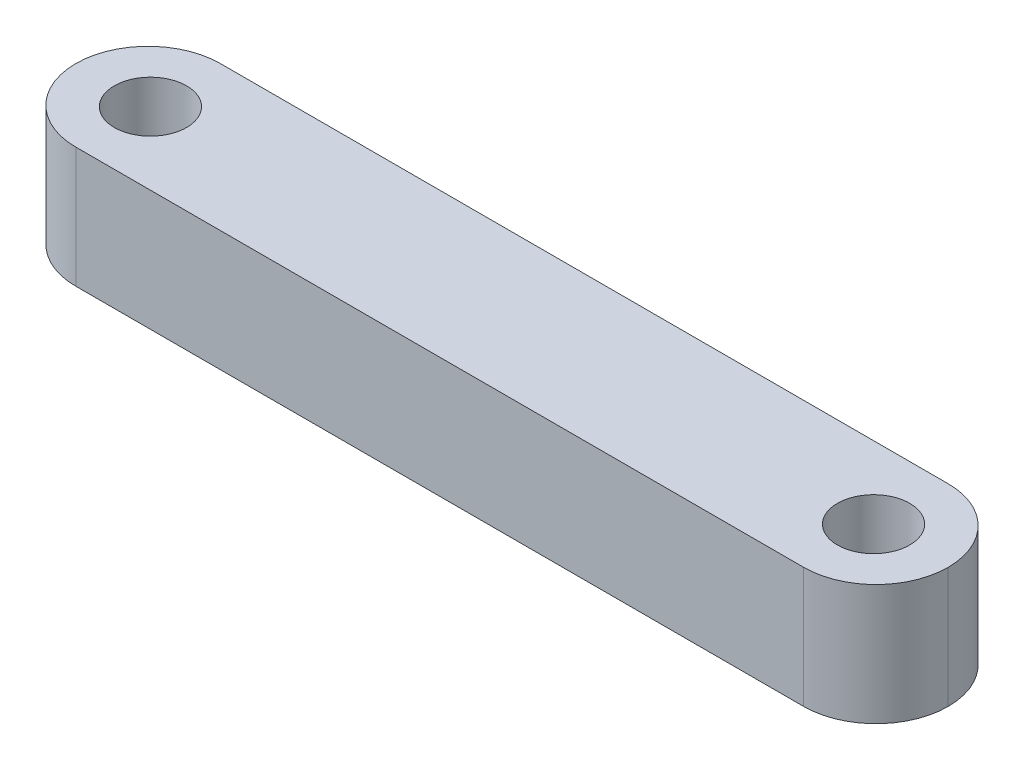
from build123d import *

# Parameters (mm, degrees)
SKETCH1_W           = 72.39
SKETCH1_H           = 12
SKETCH1_R           = 3
BOSS_EXTRUDE1_DEPTH = 10
FILLET1_R           = 6


with BuildPart() as part:
    # Sketch1 → Boss-Extrude1 (new body)
    with BuildSketch(Plane(origin=(0, 0, 0), x_dir=(1, 0, 0), z_dir=(0, 1, 0))):
        Rectangle(SKETCH1_W, SKETCH1_H)
        with Locations(Location((30, 0, 0), (0, 0, 270))):
            Circle(SKETCH1_R, mode=Mode.SUBTRACT)
        with Locations(Location((-30, 0, 0), (0, 0, 270))):
            Circle(SKETCH1_R, mode=Mode.SUBTRACT)
    extrude(amount=BOSS_EXTRUDE1_DEPTH)

    # Fillet1
    fillet1_edges = [part.edges().sort_by_distance(p)[0] for p in [
        (36.195, 5, -6),
        (36.195, 5, 6),
        (-36.195, 5, -6),
        (-36.195, 5, 6),
    ]]
    fillet(fillet1_edges, radius=FILLET1_R - 0.0001)  # a hair under: the kernel refuses the full size


solid = part.part
